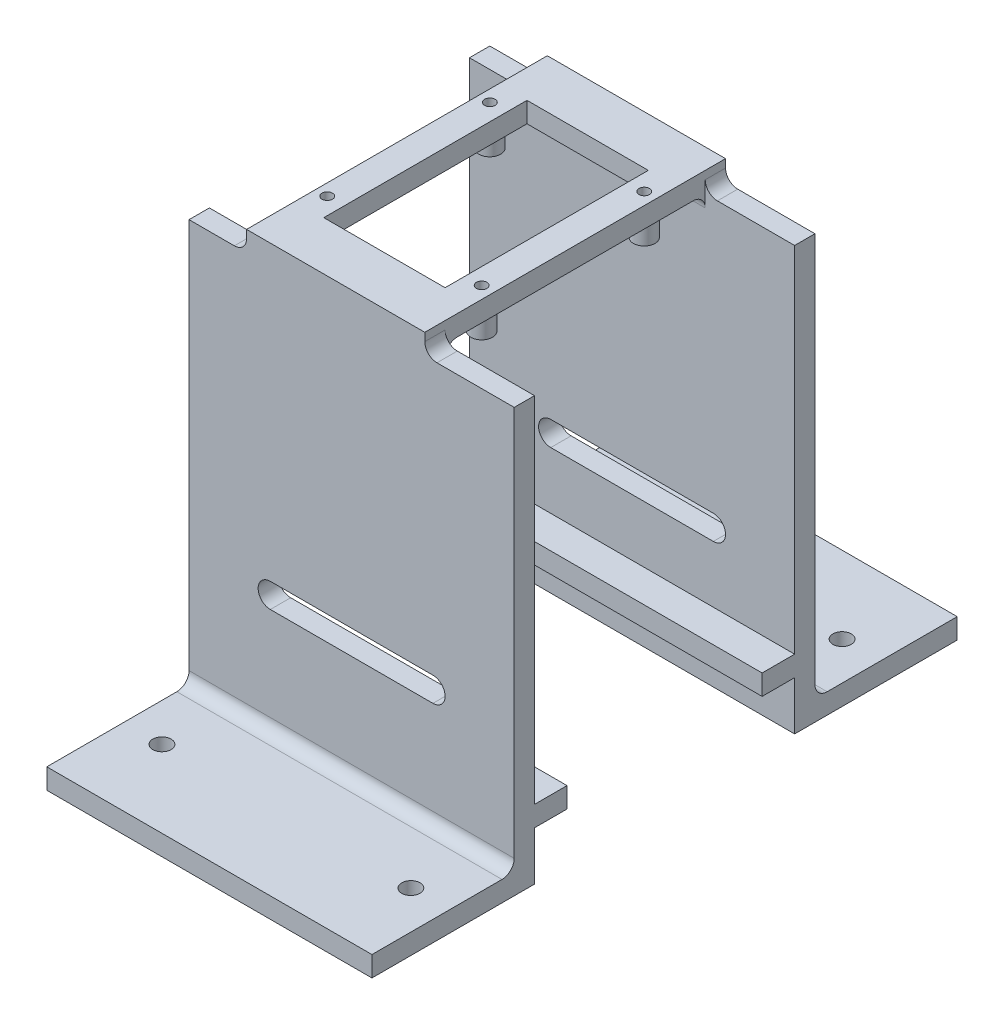
from build123d import *

# Parameters (mm, degrees)
SKETCH1_W             = 80
SKETCH1_H             = 40
SKETCH1_R             = 2.25
BOSS_EXTRUDE1_DEPTH   = 5
BOSS_EXTRUDE1_2_DEPTH = 5
SKETCH2_W             = 80
SKETCH2_H             = 5
BOSS_EXTRUDE2_DEPTH   = 99.09
SKETCH3_W             = 43.85
SKETCH3_H             = 74
BOSS_EXTRUDE3_DEPTH   = 5
SKETCH5_W             = 29.85
SKETCH5_H             = 50
CUT_EXTRUDE2_DEPTH    = 10
CUT_EXTRUDE1_REACH    = 138.692
SKETCH4_R             = 1.3
FILLET1_R             = 3
FILLET2_R             = 3
SKETCH9_R             = 2.65
SKETCH9_R_2           = 1.05
BOSS_EXTRUDE5_DEPTH   = 4.75
SKETCH10_W            = 12
SKETCH10_H            = 6.8
CUT_EXTRUDE4_DEPTH    = 8
SKETCH11_W            = 80
SKETCH11_H            = 5
BOSS_EXTRUDE6_DEPTH   = 8
CUT_EXTRUDE5_REACH    = 161.316


with BuildPart() as part:
    # Sketch1 → Boss-Extrude1 (new body)
    with BuildSketch(Plane(origin=(0, 0, 0), x_dir=(1, 0, 0), z_dir=(0, 1, 0))):
        with Locations((0, 52)):
            Rectangle(SKETCH1_W, SKETCH1_H)
        with Locations((-30.625, 53.044055982)):
            Circle(SKETCH1_R, mode=Mode.SUBTRACT)
        with Locations((30.625, 53.044055982)):
            Circle(SKETCH1_R, mode=Mode.SUBTRACT)
    extrude(amount=BOSS_EXTRUDE1_DEPTH)



with BuildPart() as body_2:
    # Sketch1 → Boss-Extrude1 2 (new body)
    with BuildSketch(Plane(origin=(0, 0, 0), x_dir=(1, 0, 0), z_dir=(0, 1, 0))):
        with Locations((0, -52)):
            Rectangle(SKETCH1_W, SKETCH1_H)
        with Locations((30.625, -53.044055982)):
            Circle(SKETCH1_R, mode=Mode.SUBTRACT)
        with Locations((-30.625, -53.044055982)):
            Circle(SKETCH1_R, mode=Mode.SUBTRACT)
    extrude(amount=BOSS_EXTRUDE1_2_DEPTH)


with BuildPart() as part_1:
    add(part.part)

    add(body_2.part)  # Boss-Extrude2 merges body 2
    # Sketch2 → Boss-Extrude2 (add)
    with BuildSketch(Plane(origin=(0, 5, 0), x_dir=(1, 0, 0), z_dir=(0, 1, 0))):
        with Locations((0, 34.5)):
            Rectangle(SKETCH2_W, SKETCH2_H)
        with Locations((0, -34.5)):
            Rectangle(SKETCH2_W, SKETCH2_H)
    extrude(amount=BOSS_EXTRUDE2_DEPTH)

    # Sketch3 → Boss-Extrude3 (add)
    with BuildSketch(Plane(origin=(0, 104.09, 0), x_dir=(1, 0, 0), z_dir=(0, 1, 0))):
        with Locations((-3.925, 0)):
            Rectangle(SKETCH3_W, SKETCH3_H)
    extrude(amount=BOSS_EXTRUDE3_DEPTH)

    # Sketch5 → Cut-Extrude2 (cut)
    with BuildSketch(Plane.XZ.offset(-104.09)):
        with Locations((-3.925, 0)):
            Rectangle(SKETCH5_W, SKETCH5_H)
    extrude(amount=-CUT_EXTRUDE2_DEPTH, mode=Mode.SUBTRACT)

    # Sketch4 → Cut-Extrude1 (cut, up to next)
    with BuildSketch(Plane(origin=(0, 109.09, 0), x_dir=(1, 0, 0), z_dir=(0, 1, 0)), mode=Mode.PRIVATE) as cut_extrude1_sk1:
        with Locations((-23, 20)):
            Circle(SKETCH4_R)
    cut_extrude1_tool1 = extrude(cut_extrude1_sk1.sketch, amount=-CUT_EXTRUDE1_REACH, mode=Mode.PRIVATE) & part_1.part
    # Sketch4 → Cut-Extrude1 (cut, up to next)
    with BuildSketch(Plane(origin=(0, 109.09, 0), x_dir=(1, 0, 0), z_dir=(0, 1, 0)), mode=Mode.PRIVATE) as cut_extrude1_sk2:
        with Locations((15, 20)):
            Circle(SKETCH4_R)
    cut_extrude1_tool2 = extrude(cut_extrude1_sk2.sketch, amount=-CUT_EXTRUDE1_REACH, mode=Mode.PRIVATE) & part_1.part
    # Sketch4 → Cut-Extrude1 (cut, up to next)
    with BuildSketch(Plane(origin=(0, 109.09, 0), x_dir=(1, 0, 0), z_dir=(0, 1, 0)), mode=Mode.PRIVATE) as cut_extrude1_sk3:
        with Locations((15, -20)):
            Circle(SKETCH4_R)
    cut_extrude1_tool3 = extrude(cut_extrude1_sk3.sketch, amount=-CUT_EXTRUDE1_REACH, mode=Mode.PRIVATE) & part_1.part
    # Sketch4 → Cut-Extrude1 (cut, up to next)
    with BuildSketch(Plane(origin=(0, 109.09, 0), x_dir=(1, 0, 0), z_dir=(0, 1, 0)), mode=Mode.PRIVATE) as cut_extrude1_sk4:
        with Locations((-23, -20)):
            Circle(SKETCH4_R)
    cut_extrude1_tool4 = extrude(cut_extrude1_sk4.sketch, amount=-CUT_EXTRUDE1_REACH, mode=Mode.PRIVATE) & part_1.part
    add(cut_extrude1_tool1.solids().sort_by_distance((-23, 109.09, -20))[0], mode=Mode.SUBTRACT)
    add(cut_extrude1_tool2.solids().sort_by_distance((15, 109.09, -20))[0], mode=Mode.SUBTRACT)
    add(cut_extrude1_tool3.solids().sort_by_distance((15, 109.09, 20))[0], mode=Mode.SUBTRACT)
    add(cut_extrude1_tool4.solids().sort_by_distance((-23, 109.09, 20))[0], mode=Mode.SUBTRACT)

    # Fillet1
    fillet1_edges = [part_1.edges().sort_by_distance(p)[0] for p in [
        (-3.925, 104.09, -32),
        (-3.925, 104.09, 32),
        (0, 5, -37),
        (0, 5, 37),
    ]]
    fillet(fillet1_edges, radius=FILLET1_R)

    # Fillet2
    fillet2_edges = [part_1.edges().sort_by_distance(p)[0] for p in [
        (18, 104.09, -34.5),
        (-25.85, 104.09, -34.5),
        (-25.85, 104.09, 34.5),
        (18, 104.09, 34.5),
    ]]
    fillet(fillet2_edges, radius=FILLET2_R)

    # Sketch9 → Boss-Extrude5 (add)
    # profile 1 of 4: a face of its own
    with BuildSketch(Plane.XZ.offset(-104.09)):
        with Locations((-23, 20)):
            Circle(SKETCH9_R)
        with Locations((-23, 20)):
            Circle(SKETCH9_R_2, mode=Mode.SUBTRACT)
    # profile 2 of 4: a face of its own
    with BuildSketch(Plane.XZ.offset(-104.09)):
        with Locations((-23, -20)):
            Circle(SKETCH9_R)
        with Locations((-23, -20)):
            Circle(SKETCH9_R_2, mode=Mode.SUBTRACT)
    # profile 3 of 4: a face of its own
    with BuildSketch(Plane.XZ.offset(-104.09)):
        with Locations((15, 20)):
            Circle(SKETCH9_R)
        with Locations((15, 20)):
            Circle(SKETCH9_R_2, mode=Mode.SUBTRACT)
    # profile 4 of 4: a face of its own
    with BuildSketch(Plane.XZ.offset(-104.09)):
        with Locations((15, -20)):
            Circle(SKETCH9_R)
        with Locations((15, -20)):
            Circle(SKETCH9_R_2, mode=Mode.SUBTRACT)
    extrude(amount=BOSS_EXTRUDE5_DEPTH)

    # Sketch10 → Cut-Extrude4 (cut)
    with BuildSketch(Plane.XY.offset(37)):
        with Locations((6.7, 101.24)):
            Rectangle(SKETCH10_W, SKETCH10_H)
    extrude(amount=-CUT_EXTRUDE4_DEPTH, mode=Mode.SUBTRACT)

    # Sketch11 → Boss-Extrude6 (add)
    with BuildSketch(Plane(origin=(0, 0, 32), x_dir=(-1, 0, 0), z_dir=(0, 0, -1))):
        with Locations((0, 14.5)):
            Rectangle(SKETCH11_W, SKETCH11_H)
    extrude(amount=BOSS_EXTRUDE6_DEPTH)

    # Mirror3: part across plane


with BuildPart() as part_2:
    add(part_1.part)
    add(part_1.part.mirror(Plane.XY))

    # Sketch12 → Cut-Extrude5 (cut, up to next)
    with BuildSketch(Plane(origin=(0, 0, -37), x_dir=(-1, 0, 0), z_dir=(0, 0, -1)), mode=Mode.PRIVATE) as cut_extrude5_sk1:
        with BuildLine():
            Line((20, 31.025), (-20, 31.025))
            ThreePointArc((-20, 31.025), (-23, 34.025), (-20, 37.025))
            Line((-20, 37.025), (20, 37.025))
            ThreePointArc((20, 37.025), (23, 34.025), (20, 31.025))
        make_face()
    cut_extrude5_tool1 = extrude(cut_extrude5_sk1.sketch, amount=-CUT_EXTRUDE5_REACH, mode=Mode.PRIVATE) & part_2.part
    cut_extrude5 = cut_extrude5_tool1.solids().sort_by_distance((0, 34.025, -37))[0]
    add(cut_extrude5, mode=Mode.SUBTRACT)

    # Mirror4: Cut-Extrude5 across plane
    add(cut_extrude5.mirror(Plane.XY), mode=Mode.SUBTRACT)


solid = part_2.part
